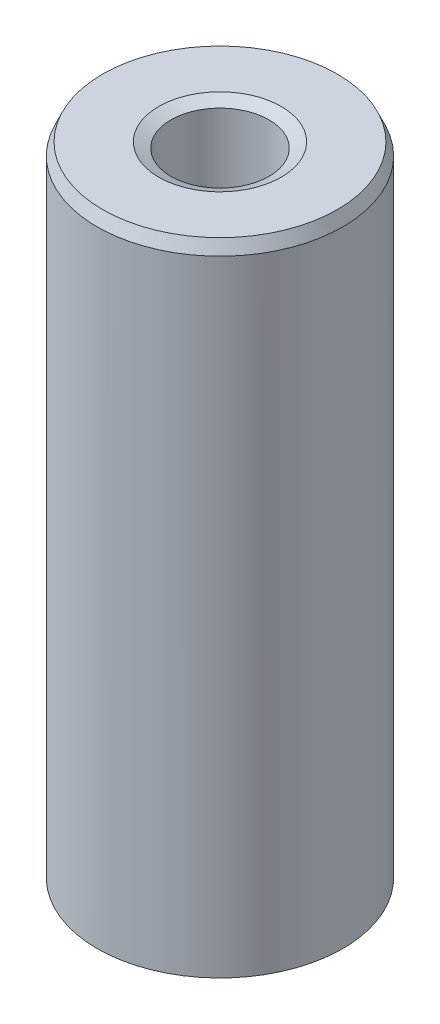
from build123d import *
from OCP.BRepFilletAPI import BRepFilletAPI_MakeChamfer

# Parameters (mm, degrees)
SKETCH1_R           = 7.5
BOSS_EXTRUDE1_DEPTH = 39.257903862
SKETCH2_R           = 2.993644286
CUT_EXTRUDE1_DEPTH  = 41.665501542
CHAMFER1_SIZE       = 0.749363679
CHAMFER1_SIZE2      = 0.331876314


with BuildPart() as part:
    # Sketch1 → Boss-Extrude1 (new body)
    with BuildSketch(Plane(origin=(0, 0, 0), x_dir=(1, 0, 0), z_dir=(0, 1, 0))):
        Circle(SKETCH1_R)
    extrude(amount=BOSS_EXTRUDE1_DEPTH)

    # Sketch2 → Cut-Extrude1 (cut, through all)
    with BuildSketch(Plane(origin=(0, 0, 0), x_dir=(1, 0, 0), z_dir=(0, 1, 0))):
        Circle(SKETCH2_R)
    extrude(amount=CUT_EXTRUDE1_DEPTH, mode=Mode.SUBTRACT)

    # Chamfer1: one chamfer whose edges measure the first distance from different faces: ONE call of the kernel's chamfer builder (chamfer() names one face for all edges)
    chamfer1_edges_1 = [part.edges().sort_by_distance(p)[0] for p in [
        (-2.993644286, 39.257903862, 0),
    ]]
    chamfer1_side_1 = [part.faces().sort_by_distance(p)[0] for p in [
        (-7.287867966, 39.257903862, 0),
    ]]
    chamfer1_edges_2 = [part.edges().sort_by_distance(p)[0] for p in [
        (-2.993644286, 0, 0),
    ]]
    chamfer1_side_2 = [part.faces().sort_by_distance(p)[0] for p in [
        (-2.993644286, 19.628951931, 0),
    ]]
    chamfer1_edges_3 = [part.edges().sort_by_distance(p)[0] for p in [
        (-7.5, 0, 0),
    ]]
    chamfer1_side_3 = [part.faces().sort_by_distance(p)[0] for p in [
        (-7.287867966, 0, 0),
    ]]
    chamfer1_edges_4 = [part.edges().sort_by_distance(p)[0] for p in [
        (-7.5, 39.257903862, 0),
    ]]
    chamfer1_side_4 = [part.faces().sort_by_distance(p)[0] for p in [
        (-7.5, 19.628951931, 0),
    ]]
    chamfer1 = BRepFilletAPI_MakeChamfer(part.part.solid().wrapped)
    for e in chamfer1_edges_1:
        chamfer1.Add(CHAMFER1_SIZE, CHAMFER1_SIZE2, e.wrapped, chamfer1_side_1[0].wrapped)  # the first distance lies on this face
    for e in chamfer1_edges_2:
        chamfer1.Add(CHAMFER1_SIZE, CHAMFER1_SIZE2, e.wrapped, chamfer1_side_2[0].wrapped)  # the first distance lies on this face
    for e in chamfer1_edges_3:
        chamfer1.Add(CHAMFER1_SIZE, CHAMFER1_SIZE2, e.wrapped, chamfer1_side_3[0].wrapped)  # the first distance lies on this face
    for e in chamfer1_edges_4:
        chamfer1.Add(CHAMFER1_SIZE, CHAMFER1_SIZE2, e.wrapped, chamfer1_side_4[0].wrapped)  # the first distance lies on this face
    add(Compound.cast(chamfer1.Shape()), mode=Mode.REPLACE)


solid = part.part
